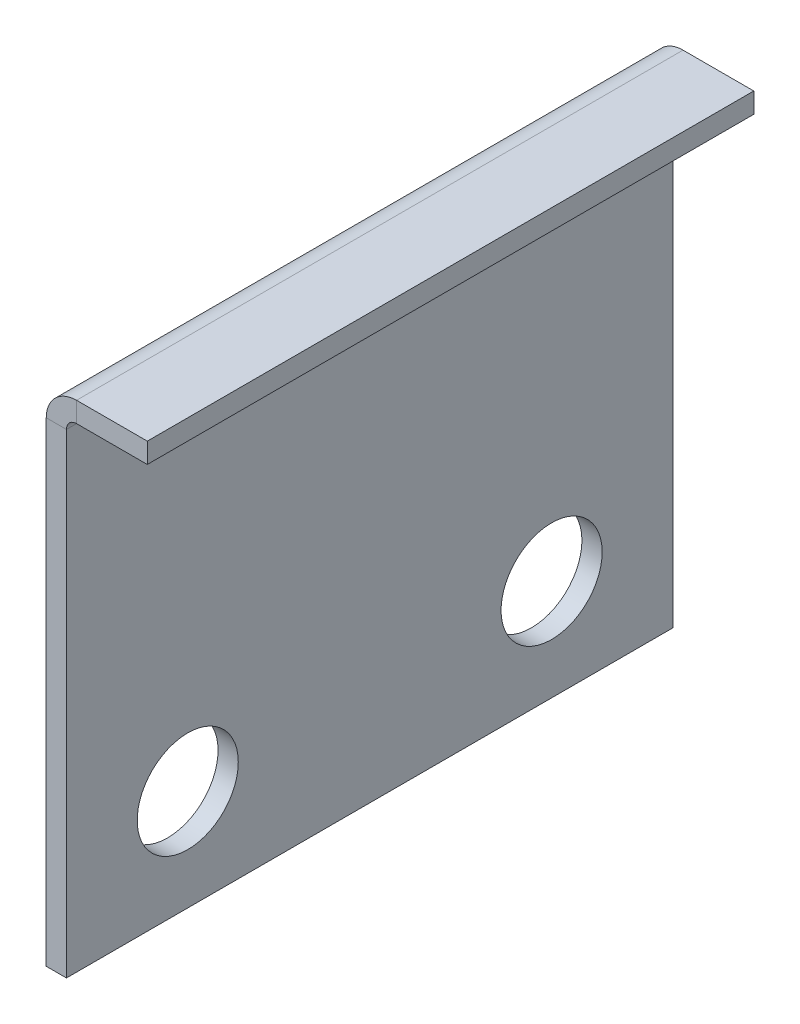
from build123d import *

# Parameters (mm, degrees)
SM_BASE_FLANGE_1_DEPTH = 15
CUT_EXTRUDE_1_REACH    = 31.428
SKETCH_3_R             = 2.5


# Sheet-metal steps are written as plain solids
with BuildPart() as part:
    # Sketch 1 → 基体-法兰1 (new, symmetric)
    with BuildSketch(Plane.XY):
        with BuildLine():
            Line((0, -25), (0, -1.5))
            ThreePointArc((0, -1.5), (0.439339828, -0.439339828), (1.5, 0))
            Line((1.5, 0), (5, 0))
            Line((5, 0), (5, -1))
            Line((5, -1), (1.5, -1))
            ThreePointArc((1.5, -1), (1.146446609, -1.146446609), (1, -1.5))
            Line((1, -1.5), (1, -25))
            Line((1, -25), (0, -25))
        make_face()
    extrude(amount=SM_BASE_FLANGE_1_DEPTH, both=True)

    # 草图3 → 切除-拉伸1 (cut, up to next)
    with BuildSketch(Plane(origin=(1, 0, 0), x_dir=(0, 0, -1), z_dir=(1, 0, 0)), mode=Mode.PRIVATE) as cut_extrude_1_sk1:
        with Locations((-9, -20)):
            Circle(SKETCH_3_R)
    cut_extrude_1_tool1 = extrude(cut_extrude_1_sk1.sketch, amount=-CUT_EXTRUDE_1_REACH, mode=Mode.PRIVATE) & part.part
    # 草图3 → 切除-拉伸1 (cut, up to next)
    with BuildSketch(Plane(origin=(1, 0, 0), x_dir=(0, 0, -1), z_dir=(1, 0, 0)), mode=Mode.PRIVATE) as cut_extrude_1_sk2:
        with Locations((9, -20)):
            Circle(SKETCH_3_R)
    cut_extrude_1_tool2 = extrude(cut_extrude_1_sk2.sketch, amount=-CUT_EXTRUDE_1_REACH, mode=Mode.PRIVATE) & part.part
    add(cut_extrude_1_tool1.solids().sort_by_distance((1, -20, 9))[0], mode=Mode.SUBTRACT)
    add(cut_extrude_1_tool2.solids().sort_by_distance((1, -20, -9))[0], mode=Mode.SUBTRACT)


solid = part.part
